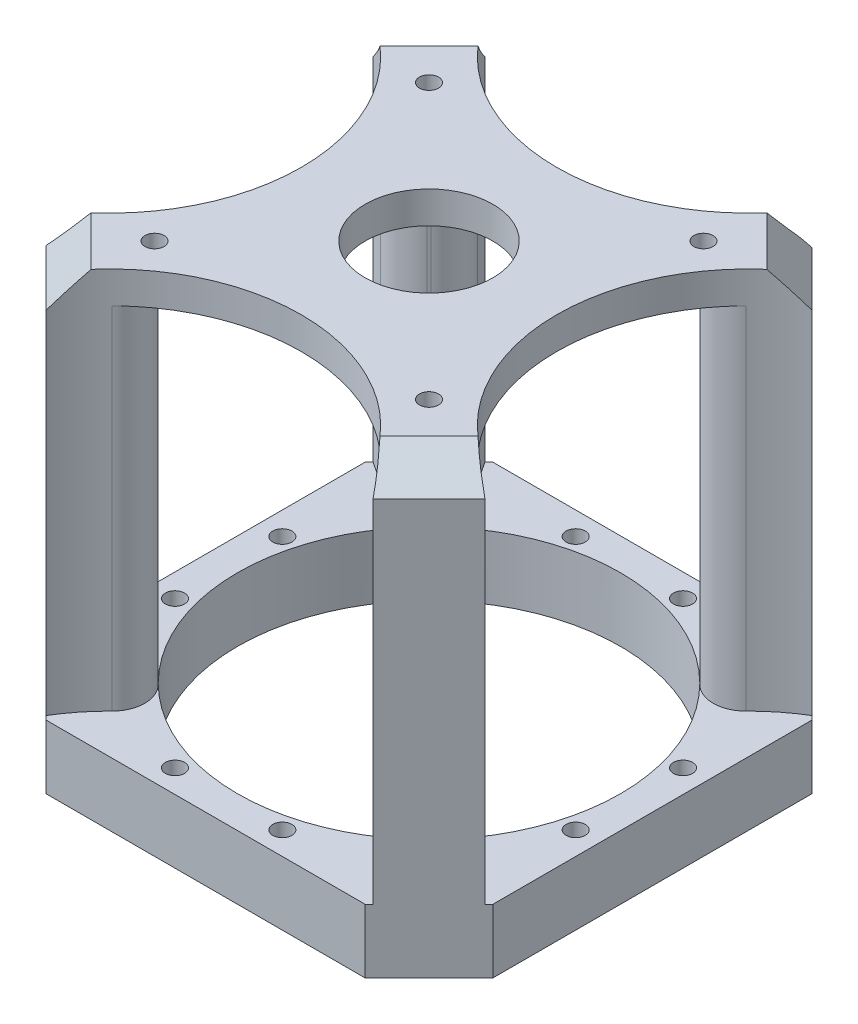
from build123d import *

# Parameters (mm, degrees)
SKETCH1_W           = 70
SKETCH1_H           = 70
SKETCH1_R           = 30
SKETCH1_R_2         = 1.5
BOSS_EXTRUDE1_DEPTH = 65
SKETCH2_W           = 70
SKETCH2_H           = 70
SKETCH2_R           = 1.5
SKETCH2_R_2         = 10
BOSS_EXTRUDE2_DEPTH = 5
SKETCH3_R           = 30
CUT_EXTRUDE1_DEPTH  = 60
CIRPATTERN1_COUNT   = 4
FILLET2_R           = 5.1
CHAMFER1_SIZE       = 10
CHAMFER2_SIZE       = 5


with BuildPart() as part:
    # Sketch1 → Boss-Extrude1 (new body)
    with BuildSketch(Plane(origin=(0, 0, 0), x_dir=(1, 0, 0), z_dir=(0, 1, 0))):
        Rectangle(SKETCH1_W, SKETCH1_H)
        with Locations(Location((0, 0, 0), (0, 0, 270))):
            Circle(SKETCH1_R, mode=Mode.SUBTRACT)
        with Locations(Location((-8.411618966, 31.392589354, 0), (0, 0, 270))):
            Circle(SKETCH1_R_2, mode=Mode.SUBTRACT)
        with Locations(Location((8.411618966, 31.392589354, 0), (0, 0, 270))):
            Circle(SKETCH1_R_2, mode=Mode.SUBTRACT)
        with Locations(Location((31.392589354, 8.411618966, 0), (0, 0, 270))):
            Circle(SKETCH1_R_2, mode=Mode.SUBTRACT)
        with Locations(Location((31.392589354, -8.411618966, 0), (0, 0, 270))):
            Circle(SKETCH1_R_2, mode=Mode.SUBTRACT)
        with Locations(Location((8.411618966, -31.392589354, 0), (0, 0, 270))):
            Circle(SKETCH1_R_2, mode=Mode.SUBTRACT)
        with Locations(Location((-8.411618966, -31.392589354, 0), (0, 0, 270))):
            Circle(SKETCH1_R_2, mode=Mode.SUBTRACT)
        with Locations(Location((-31.392589354, -8.411618966, 0), (0, 0, 270))):
            Circle(SKETCH1_R_2, mode=Mode.SUBTRACT)
        with Locations(Location((-31.392589354, 8.411618966, 0), (0, 0, 270))):
            Circle(SKETCH1_R_2, mode=Mode.SUBTRACT)
    extrude(amount=BOSS_EXTRUDE1_DEPTH)

    # Sketch2 → Boss-Extrude2 (add)
    with BuildSketch(Plane(origin=(0, 65, 0), x_dir=(1, 0, 0), z_dir=(0, 1, 0))):
        Rectangle(SKETCH2_W, SKETCH2_H)
        with Locations(Location((0, 32.5, 0), (0, 0, 270))):
            Circle(SKETCH2_R, mode=Mode.SUBTRACT)
        with Locations(Location((16.25, 28.145825623, 0), (0, 0, 270))):
            Circle(SKETCH2_R, mode=Mode.SUBTRACT)
        with Locations(Location((28.145825623, 16.25, 0), (0, 0, 270))):
            Circle(SKETCH2_R, mode=Mode.SUBTRACT)
        with Locations(Location((32.5, 0, 0), (0, 0, 270))):
            Circle(SKETCH2_R, mode=Mode.SUBTRACT)
        with Locations(Location((28.145825623, -16.25, 0), (0, 0, 270))):
            Circle(SKETCH2_R, mode=Mode.SUBTRACT)
        with Locations(Location((16.25, -28.145825623, 0), (0, 0, 270))):
            Circle(SKETCH2_R, mode=Mode.SUBTRACT)
        with Locations(Location((0, -32.5, 0), (0, 0, 270))):
            Circle(SKETCH2_R, mode=Mode.SUBTRACT)
        with Locations(Location((-16.25, -28.145825623, 0), (0, 0, 270))):
            Circle(SKETCH2_R, mode=Mode.SUBTRACT)
        with Locations(Location((-28.145825623, -16.25, 0), (0, 0, 270))):
            Circle(SKETCH2_R, mode=Mode.SUBTRACT)
        with Locations(Location((-32.5, 0, 0), (0, 0, 270))):
            Circle(SKETCH2_R, mode=Mode.SUBTRACT)
        with Locations(Location((-28.145825623, 16.25, 0), (0, 0, 270))):
            Circle(SKETCH2_R, mode=Mode.SUBTRACT)
        with Locations(Location((-16.25, 28.145825623, 0), (0, 0, 270))):
            Circle(SKETCH2_R, mode=Mode.SUBTRACT)
        with Locations(Location((0, 0, 0), (0, 0, 270))):
            Circle(SKETCH2_R_2, mode=Mode.SUBTRACT)
        with Locations(Location((-21.5, 21.5, 0), (0, 0, 27.946923368))):
            Circle(SKETCH2_R, mode=Mode.SUBTRACT)
        with Locations(Location((21.5, 21.5, 0), (0, 0, 152.053076632))):
            Circle(SKETCH2_R, mode=Mode.SUBTRACT)
        with Locations(Location((21.5, -21.5, 0), (0, 0, 62.053076632))):
            Circle(SKETCH2_R, mode=Mode.SUBTRACT)
        with Locations(Location((-21.5, -21.5, 0), (0, 0, 117.946923368))):
            Circle(SKETCH2_R, mode=Mode.SUBTRACT)
    extrude(amount=BOSS_EXTRUDE2_DEPTH)

    # Sketch3 → Cut-Extrude1 (cut)
    with BuildSketch(Plane(origin=(0, 70, 0), x_dir=(1, 0, 0), z_dir=(0, 1, 0))):
        with Locations((0, 50)):
            Circle(SKETCH3_R)
    cut_extrude1 = extrude(amount=-CUT_EXTRUDE1_DEPTH, mode=Mode.SUBTRACT)

    # CirPattern1: Cut-Extrude1 ×4 about axis
    cirpattern1_axis = Axis((0, 0, 0), (0, 1, 0))
    for i in range(1, CIRPATTERN1_COUNT):
        add(cut_extrude1.rotate(cirpattern1_axis, i * 360 / CIRPATTERN1_COUNT), mode=Mode.SUBTRACT)

    # Fillet2
    # the kernel refuses this fillet: 5.1 mm, written as the material it takes off along each edge
    with BuildSketch(Plane(origin=(25.980762114, 10, -35), x_dir=(1, 0, 0), z_dir=(0, 1, 0))) as fillet2_piece_1:
        with BuildLine():
            CenterArc((2.794227026, -5.1), FILLET2_R, 90, 55.064804049)
            ThreePointArc((-1.386754302, -2.179487179), (-0.669907143, -1.104676981), (0, 0))
            Line((0, 0), (2.794227026, 0))
        make_face()
    extrude(amount=66.985567566, mode=Mode.SUBTRACT)
    with BuildSketch(Plane(origin=(16.583123952, 65, -25), x_dir=(0.7763821649146441, 0, 0.6302624326440933), z_dir=(0, -1, 0)), Plane(origin=(16.583123952, 65, 25), x_dir=(0.776382164914642, 0, 0.6302624326440961), z_dir=(0, -1, 0)), Plane(origin=(25, 65, 16.583123952), x_dir=(-0.6302624326440963, 0, 0.7763821649146417), z_dir=(0, -1, 0)), Plane(origin=(-25, 65, 16.583123952), x_dir=(-0.630262432644093, 0, 0.7763821649146444), z_dir=(0, -1, 0))) as fillet2_piece_2:
        with BuildLine():
            CenterArc((6.253330537, -5.076416608), FILLET2_R, 95.512177233, 90.836671542)
            ThreePointArc((1.184608644, -5.640383249), (0.728068224, -2.79167812), (0, 0))
            ThreePointArc((0, 0), (2.881719141, -0.138725834), (5.763438283, 0))
        make_face()
    extrude(amount=55, mode=Mode.SUBTRACT)
    with BuildSketch(Plane(origin=(-16.583123952, 65, -25), x_dir=(-0.7763821649146441, 0, 0.6302624326440932), z_dir=(0, -1, 0)), Plane(origin=(-16.583123952, 65, 25), x_dir=(-0.7763821649146462, 0, 0.6302624326440908), z_dir=(0, -1, 0)), Plane(origin=(25, 65, -16.583123952), x_dir=(-0.6302624326440941, 0, -0.7763821649146434), z_dir=(0, -1, 0)), Plane(origin=(-25, 65, -16.583123952), x_dir=(-0.6302624326440903, 0, -0.7763821649146465), z_dir=(0, -1, 0))) as fillet2_piece_3:
        with BuildLine():
            CenterArc((6.253330537, 5.076416608), FILLET2_R, 173.651151224, 90.836671542)
            ThreePointArc((1.184608644, 5.640383249), (0.728068224, 2.79167812), (0, 0))
            ThreePointArc((0, 0), (2.881719141, 0.138725834), (5.763438283, 0))
        make_face()
    extrude(amount=55, mode=Mode.SUBTRACT)

    # Chamfer1
    # the kernel refuses this chamfer: 10 mm, written as the material it takes off along each edge
    with BuildSketch(Plane(origin=(35, -25.71682988, 35), x_dir=(-0.9996219169112968, 0, 0.027495876610586317), z_dir=(0, 1, 0)), Plane(origin=(-35, 95.71682988, 35), x_dir=(0.9996219169112968, 0, 0.027495876610586317), z_dir=(0, -1, 0))) as chamfer1_piece_1:
        Polygon((CHAMFER1_SIZE * 0.999621916911, -CHAMFER1_SIZE * 0.0274958766106), (-CHAMFER1_SIZE * 0.0274958766106, -CHAMFER1_SIZE * 0.999621916911), (0, 0), align=None)
    extrude(amount=121.433659759, mode=Mode.SUBTRACT)
    with BuildSketch(Plane(origin=(35, -25.71682988, -35), x_dir=(-0.9996219169112968, 0, -0.027495876610586317), z_dir=(0, 1, 0)), Plane(origin=(-35, 95.71682988, -35), x_dir=(0.9996219169112968, 0, -0.027495876610586317), z_dir=(0, -1, 0))) as chamfer1_piece_2:
        Polygon((CHAMFER1_SIZE * 0.999621916911, CHAMFER1_SIZE * 0.0274958766106), (-CHAMFER1_SIZE * 0.0274958766106, CHAMFER1_SIZE * 0.999621916911), (0, 0), align=None)
    extrude(amount=121.433659759, mode=Mode.SUBTRACT)

    # Chamfer2
    chamfer2_edges = [part.edges().sort_by_distance(p)[0] for p in [
        (-30, 70, 30),
        (30, 70, 30),
        (30.138549403, 70, -29.861450597),
        (-30, 70, -30),
    ]]
    chamfer(chamfer2_edges, length=CHAMFER2_SIZE)


solid = part.part
